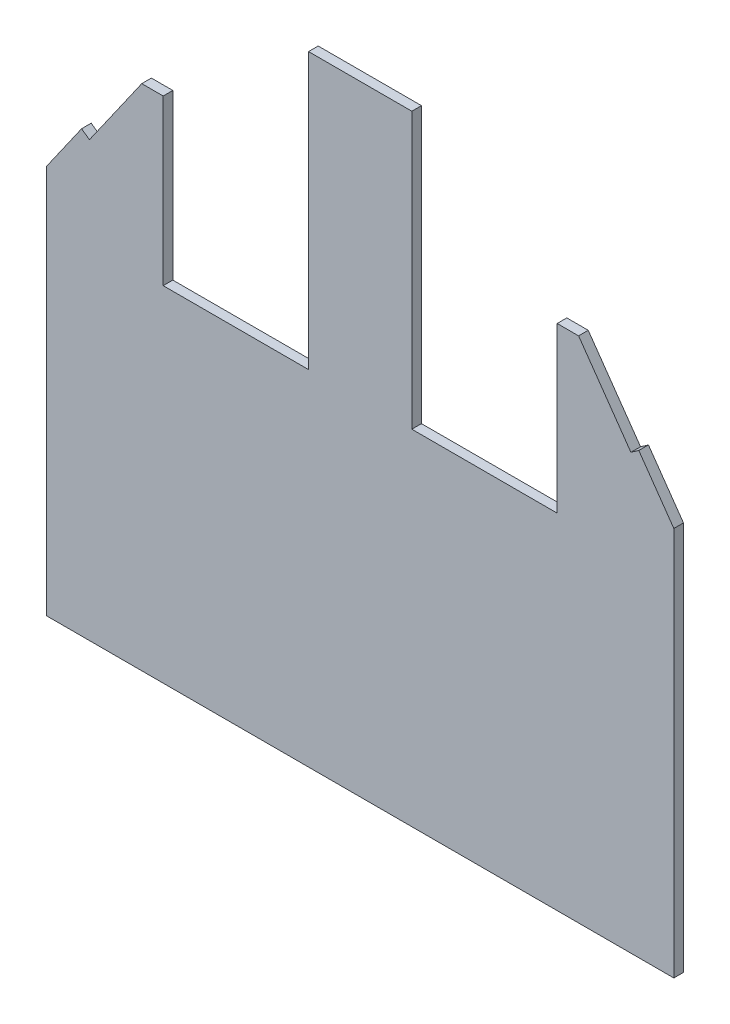
from build123d import *

# Parameters (mm, degrees)
BOSS_EXTRUDE1_DEPTH = 1.6


with BuildPart() as part:
    # Sketch1 → Boss-Extrude1 (new body)
    with BuildSketch(Plane.XY):
        Polygon((28.709931294, 44.827553592), (25.152877, 44.827553592), (25.152877, 17.561047041), (1.022877, 17.561047041), (1.022877, 63.281047041), (-16.122123, 63.281047041), (-16.122123, 17.561047041), (-40.252123, 17.561047041), (-40.252123, 44.827553592), (-43.809177295, 44.827553592), (-52.491943219, 32.427278744), (-53.80258649, 33.345001042), (-59.619623, 25.037411944), (-59.619623, -39.588952959), (44.520377, -39.588952959), (44.520377, 25.037411944), (38.703340489, 33.345001042), (37.392697218, 32.427278744), align=None)
    extrude(amount=BOSS_EXTRUDE1_DEPTH)


solid = part.part
